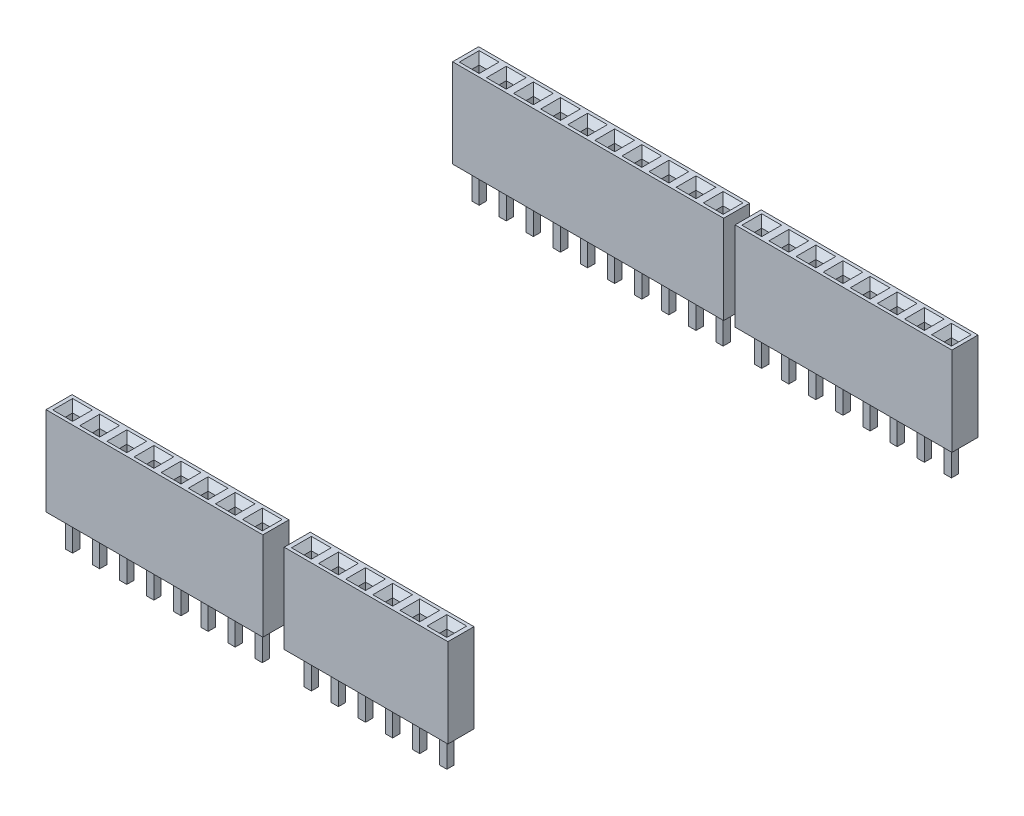
from build123d import *

# Parameters (mm, degrees)
ESQUISSE1_W             = 20.8
ESQUISSE1_H             = 2.5
BOSS_EXTRU_1_DEPTH      = 8.5
ESQUISSE1_W_2           = 15.7
BOSS_EXTRU_1_2_DEPTH    = 8.5
BOSS_EXTRU_1_3_DEPTH    = 8.5
ESQUISSE1_W_3           = 26
BOSS_EXTRU_1_4_DEPTH    = 8.5
ESQUISSE2_W             = 0.7
ESQUISSE2_H             = 0.7
BOSS_EXTRU_2_DEPTH      = 3.2
CHANFREIN1_SIZE         = 0.15
CHANFREIN2_SIZE         = 0.15
CHANFREIN3_SIZE         = 0.15
CHANFREIN4_SIZE         = 0.15
ESQUISSE3_W             = 0.7
ESQUISSE3_H             = 0.7
ENL_V_MAT_EXTRU_1_DEPTH = 7
CHANFREIN5_SIZE         = 0.6
CHANFREIN6_SIZE         = 0.6
CHANFREIN7_SIZE         = 0.6
CHANFREIN8_SIZE         = 0.6


with BuildPart() as part:
    # Esquisse1 → Boss.-Extru.1 (new body)
    with BuildSketch(Plane(origin=(0, 0, 0), x_dir=(1, 0, 0), z_dir=(0, 1, 0))):
        with Locations((10.4, 1.25)):
            Rectangle(ESQUISSE1_W, ESQUISSE1_H)
    extrude(amount=BOSS_EXTRU_1_DEPTH)



with BuildPart() as body_2:
    # Esquisse1 → Boss.-Extru.1 2 (new body)
    with BuildSketch(Plane(origin=(0, 0, 0), x_dir=(1, 0, 0), z_dir=(0, 1, 0))):
        with Locations((30.7, 1.25)):
            Rectangle(ESQUISSE1_W_2, ESQUISSE1_H)
    extrude(amount=BOSS_EXTRU_1_2_DEPTH)


with BuildPart() as body_3:
    # Esquisse1 → Boss.-Extru.1 3 (new body)
    with BuildSketch(Plane(origin=(0, 0, 0), x_dir=(1, 0, 0), z_dir=(0, 1, 0))):
        with Locations((28.1, 49.65)):
            Rectangle(ESQUISSE1_W, ESQUISSE1_H)
    extrude(amount=BOSS_EXTRU_1_3_DEPTH)


with BuildPart() as body_4:
    # Esquisse1 → Boss.-Extru.1 4 (new body)
    with BuildSketch(Plane(origin=(0, 0, 0), x_dir=(1, 0, 0), z_dir=(0, 1, 0))):
        with Locations((3.6, 49.65)):
            Rectangle(ESQUISSE1_W_3, ESQUISSE1_H)
    extrude(amount=BOSS_EXTRU_1_4_DEPTH)


with BuildPart() as part_1:
    add(part.part)

    add(body_2.part)  # Boss.-Extru.2 merges body 2

    add(body_3.part)  # Boss.-Extru.2 merges body 3

    add(body_4.part)  # Boss.-Extru.2 merges body 4
    # Esquisse2 → Boss.-Extru.2 (add)
    with BuildSketch(Plane.XZ):
        with Locations((1.3, -1.25)):
            Rectangle(ESQUISSE2_W, ESQUISSE2_H)
        with Locations((3.9, -1.25)):
            Rectangle(ESQUISSE2_W, ESQUISSE2_H)
        with Locations((6.5, -1.25)):
            Rectangle(ESQUISSE2_W, ESQUISSE2_H)
        with Locations((9.1, -1.25)):
            Rectangle(ESQUISSE2_W, ESQUISSE2_H)
        with Locations((11.7, -1.25)):
            Rectangle(ESQUISSE2_W, ESQUISSE2_H)
        with Locations((14.3, -1.25)):
            Rectangle(ESQUISSE2_W, ESQUISSE2_H)
        with Locations((16.9, -1.25)):
            Rectangle(ESQUISSE2_W, ESQUISSE2_H)
        with Locations((19.5, -1.25)):
            Rectangle(ESQUISSE2_W, ESQUISSE2_H)
        with Locations((24.2, -1.25)):
            Rectangle(ESQUISSE2_W, ESQUISSE2_H)
        with Locations((26.8, -1.25)):
            Rectangle(ESQUISSE2_W, ESQUISSE2_H)
        with Locations((29.4, -1.25)):
            Rectangle(ESQUISSE2_W, ESQUISSE2_H)
        with Locations((32, -1.25)):
            Rectangle(ESQUISSE2_W, ESQUISSE2_H)
        with Locations((34.6, -1.25)):
            Rectangle(ESQUISSE2_W, ESQUISSE2_H)
        with Locations((37.2, -1.25)):
            Rectangle(ESQUISSE2_W, ESQUISSE2_H)
        with Locations((-8.1, -49.65)):
            Rectangle(ESQUISSE2_W, ESQUISSE2_H)
        with Locations((-5.5, -49.65)):
            Rectangle(ESQUISSE2_W, ESQUISSE2_H)
        with Locations((-2.9, -49.65)):
            Rectangle(ESQUISSE2_W, ESQUISSE2_H)
        with Locations((-0.3, -49.65)):
            Rectangle(ESQUISSE2_W, ESQUISSE2_H)
        with Locations((2.3, -49.65)):
            Rectangle(ESQUISSE2_W, ESQUISSE2_H)
        with Locations((4.9, -49.65)):
            Rectangle(ESQUISSE2_W, ESQUISSE2_H)
        with Locations((7.5, -49.65)):
            Rectangle(ESQUISSE2_W, ESQUISSE2_H)
        with Locations((10.1, -49.65)):
            Rectangle(ESQUISSE2_W, ESQUISSE2_H)
        with Locations((12.7, -49.65)):
            Rectangle(ESQUISSE2_W, ESQUISSE2_H)
        with Locations((15.3, -49.65)):
            Rectangle(ESQUISSE2_W, ESQUISSE2_H)
        with Locations((19, -49.65)):
            Rectangle(ESQUISSE2_W, ESQUISSE2_H)
        with Locations((21.6, -49.65)):
            Rectangle(ESQUISSE2_W, ESQUISSE2_H)
        with Locations((24.2, -49.65)):
            Rectangle(ESQUISSE2_W, ESQUISSE2_H)
        with Locations((26.8, -49.65)):
            Rectangle(ESQUISSE2_W, ESQUISSE2_H)
        with Locations((29.4, -49.65)):
            Rectangle(ESQUISSE2_W, ESQUISSE2_H)
        with Locations((32, -49.65)):
            Rectangle(ESQUISSE2_W, ESQUISSE2_H)
        with Locations((34.6, -49.65)):
            Rectangle(ESQUISSE2_W, ESQUISSE2_H)
        with Locations((37.2, -49.65)):
            Rectangle(ESQUISSE2_W, ESQUISSE2_H)
    extrude(amount=BOSS_EXTRU_2_DEPTH)

    # Chanfrein1
    chanfrein1_edges = [part_1.edges().sort_by_distance(p)[0] for p in [
        (19.5, -3.2, -0.9),
        (19.85, -3.2, -1.25),
        (19.5, -3.2, -1.6),
        (19.15, -3.2, -1.25),
        (16.9, -3.2, -0.9),
        (17.25, -3.2, -1.25),
        (16.9, -3.2, -1.6),
        (16.55, -3.2, -1.25),
        (14.3, -3.2, -0.9),
        (14.65, -3.2, -1.25),
        (14.3, -3.2, -1.6),
        (13.95, -3.2, -1.25),
        (11.7, -3.2, -0.9),
        (12.05, -3.2, -1.25),
        (11.7, -3.2, -1.6),
        (11.35, -3.2, -1.25),
        (9.1, -3.2, -0.9),
        (9.45, -3.2, -1.25),
        (9.1, -3.2, -1.6),
        (8.75, -3.2, -1.25),
        (6.5, -3.2, -0.9),
        (6.85, -3.2, -1.25),
        (6.5, -3.2, -1.6),
        (6.15, -3.2, -1.25),
        (3.9, -3.2, -0.9),
        (4.25, -3.2, -1.25),
        (3.9, -3.2, -1.6),
        (3.55, -3.2, -1.25),
        (1.3, -3.2, -0.9),
        (1.65, -3.2, -1.25),
        (1.3, -3.2, -1.6),
        (0.95, -3.2, -1.25),
    ]]
    chamfer(chanfrein1_edges, length=CHANFREIN1_SIZE)

    # Chanfrein2
    chanfrein2_edges = [part_1.edges().sort_by_distance(p)[0] for p in [
        (37.2, -3.2, -0.9),
        (37.55, -3.2, -1.25),
        (37.2, -3.2, -1.6),
        (36.85, -3.2, -1.25),
        (34.6, -3.2, -0.9),
        (34.95, -3.2, -1.25),
        (34.6, -3.2, -1.6),
        (34.25, -3.2, -1.25),
        (32, -3.2, -0.9),
        (32.35, -3.2, -1.25),
        (32, -3.2, -1.6),
        (31.65, -3.2, -1.25),
        (29.4, -3.2, -0.9),
        (29.75, -3.2, -1.25),
        (29.4, -3.2, -1.6),
        (29.05, -3.2, -1.25),
        (26.8, -3.2, -0.9),
        (27.15, -3.2, -1.25),
        (26.8, -3.2, -1.6),
        (26.45, -3.2, -1.25),
        (24.2, -3.2, -0.9),
        (24.55, -3.2, -1.25),
        (24.2, -3.2, -1.6),
        (23.85, -3.2, -1.25),
    ]]
    chamfer(chanfrein2_edges, length=CHANFREIN2_SIZE)

    # Chanfrein3
    chanfrein3_edges = [part_1.edges().sort_by_distance(p)[0] for p in [
        (15.3, -3.2, -49.3),
        (15.65, -3.2, -49.65),
        (15.3, -3.2, -50),
        (14.95, -3.2, -49.65),
        (12.7, -3.2, -49.3),
        (13.05, -3.2, -49.65),
        (12.7, -3.2, -50),
        (12.35, -3.2, -49.65),
        (10.1, -3.2, -49.3),
        (10.45, -3.2, -49.65),
        (10.1, -3.2, -50),
        (9.75, -3.2, -49.65),
        (7.5, -3.2, -49.3),
        (7.85, -3.2, -49.65),
        (7.5, -3.2, -50),
        (7.15, -3.2, -49.65),
        (4.9, -3.2, -49.3),
        (5.25, -3.2, -49.65),
        (4.9, -3.2, -50),
        (4.55, -3.2, -49.65),
        (2.3, -3.2, -49.3),
        (2.65, -3.2, -49.65),
        (2.3, -3.2, -50),
        (1.95, -3.2, -49.65),
        (-0.3, -3.2, -49.3),
        (0.05, -3.2, -49.65),
        (-0.3, -3.2, -50),
        (-0.65, -3.2, -49.65),
        (-2.9, -3.2, -49.3),
        (-2.55, -3.2, -49.65),
        (-2.9, -3.2, -50),
        (-3.25, -3.2, -49.65),
        (-5.5, -3.2, -49.3),
        (-5.15, -3.2, -49.65),
        (-5.5, -3.2, -50),
        (-5.85, -3.2, -49.65),
        (-8.1, -3.2, -49.3),
        (-7.75, -3.2, -49.65),
        (-8.1, -3.2, -50),
        (-8.45, -3.2, -49.65),
    ]]
    chamfer(chanfrein3_edges, length=CHANFREIN3_SIZE)

    # Chanfrein4
    chanfrein4_edges = [part_1.edges().sort_by_distance(p)[0] for p in [
        (19, -3.2, -49.3),
        (19.35, -3.2, -49.65),
        (19, -3.2, -50),
        (18.65, -3.2, -49.65),
        (37.2, -3.2, -49.3),
        (37.55, -3.2, -49.65),
        (37.2, -3.2, -50),
        (36.85, -3.2, -49.65),
        (34.6, -3.2, -49.3),
        (34.95, -3.2, -49.65),
        (34.6, -3.2, -50),
        (34.25, -3.2, -49.65),
        (32, -3.2, -49.3),
        (32.35, -3.2, -49.65),
        (32, -3.2, -50),
        (31.65, -3.2, -49.65),
        (29.4, -3.2, -49.3),
        (29.75, -3.2, -49.65),
        (29.4, -3.2, -50),
        (29.05, -3.2, -49.65),
        (26.8, -3.2, -49.3),
        (27.15, -3.2, -49.65),
        (26.8, -3.2, -50),
        (26.45, -3.2, -49.65),
        (24.2, -3.2, -49.3),
        (24.55, -3.2, -49.65),
        (24.2, -3.2, -50),
        (23.85, -3.2, -49.65),
        (21.6, -3.2, -49.3),
        (21.95, -3.2, -49.65),
        (21.6, -3.2, -50),
        (21.25, -3.2, -49.65),
    ]]
    chamfer(chanfrein4_edges, length=CHANFREIN4_SIZE)

    # Esquisse3 → Enlèv. mat.-Extru.1 (cut)
    with BuildSketch(Plane(origin=(0, 8.5, 0), x_dir=(1, 0, 0), z_dir=(0, 1, 0))):
        with Locations((24.2, 49.65)):
            Rectangle(ESQUISSE3_W, ESQUISSE3_H)
        with Locations((21.6, 49.65)):
            Rectangle(ESQUISSE3_W, ESQUISSE3_H)
        with Locations((29.4, 49.65)):
            Rectangle(ESQUISSE3_W, ESQUISSE3_H)
        with Locations((26.8, 49.65)):
            Rectangle(ESQUISSE3_W, ESQUISSE3_H)
        with Locations((34.6, 49.65)):
            Rectangle(ESQUISSE3_W, ESQUISSE3_H)
        with Locations((32, 49.65)):
            Rectangle(ESQUISSE3_W, ESQUISSE3_H)
        with Locations((3.9, 1.25)):
            Rectangle(ESQUISSE3_W, ESQUISSE3_H)
        with Locations((1.3, 1.25)):
            Rectangle(ESQUISSE3_W, ESQUISSE3_H)
        with Locations((37.2, 49.65)):
            Rectangle(ESQUISSE3_W, ESQUISSE3_H)
        with Locations((6.5, 1.25)):
            Rectangle(ESQUISSE3_W, ESQUISSE3_H)
        with Locations((11.7, 1.25)):
            Rectangle(ESQUISSE3_W, ESQUISSE3_H)
        with Locations((9.1, 1.25)):
            Rectangle(ESQUISSE3_W, ESQUISSE3_H)
        with Locations((16.9, 1.25)):
            Rectangle(ESQUISSE3_W, ESQUISSE3_H)
        with Locations((14.3, 1.25)):
            Rectangle(ESQUISSE3_W, ESQUISSE3_H)
        with Locations((19.5, 1.25)):
            Rectangle(ESQUISSE3_W, ESQUISSE3_H)
        with Locations((26.8, 1.25)):
            Rectangle(ESQUISSE3_W, ESQUISSE3_H)
        with Locations((24.2, 1.25)):
            Rectangle(ESQUISSE3_W, ESQUISSE3_H)
        with Locations((29.4, 1.25)):
            Rectangle(ESQUISSE3_W, ESQUISSE3_H)
        with Locations((34.6, 1.25)):
            Rectangle(ESQUISSE3_W, ESQUISSE3_H)
        with Locations((32, 1.25)):
            Rectangle(ESQUISSE3_W, ESQUISSE3_H)
        with Locations((37.2, 1.25)):
            Rectangle(ESQUISSE3_W, ESQUISSE3_H)
        with Locations((-5.5, 49.65)):
            Rectangle(ESQUISSE3_W, ESQUISSE3_H)
        with Locations((-8.1, 49.65)):
            Rectangle(ESQUISSE3_W, ESQUISSE3_H)
        with Locations((-0.3, 49.65)):
            Rectangle(ESQUISSE3_W, ESQUISSE3_H)
        with Locations((-2.9, 49.65)):
            Rectangle(ESQUISSE3_W, ESQUISSE3_H)
        with Locations((4.9, 49.65)):
            Rectangle(ESQUISSE3_W, ESQUISSE3_H)
        with Locations((2.3, 49.65)):
            Rectangle(ESQUISSE3_W, ESQUISSE3_H)
        with Locations((10.1, 49.65)):
            Rectangle(ESQUISSE3_W, ESQUISSE3_H)
        with Locations((7.5, 49.65)):
            Rectangle(ESQUISSE3_W, ESQUISSE3_H)
        with Locations((15.3, 49.65)):
            Rectangle(ESQUISSE3_W, ESQUISSE3_H)
        with Locations((12.7, 49.65)):
            Rectangle(ESQUISSE3_W, ESQUISSE3_H)
        with Locations((19, 49.65)):
            Rectangle(ESQUISSE3_W, ESQUISSE3_H)
    extrude(amount=-ENL_V_MAT_EXTRU_1_DEPTH, mode=Mode.SUBTRACT)

    # Chanfrein5
    chanfrein5_edges = [part_1.edges().sort_by_distance(p)[0] for p in [
        (-8.1, 8.5, -49.3),
        (-8.45, 8.5, -49.65),
        (-8.1, 8.5, -50),
        (-7.75, 8.5, -49.65),
        (15.3, 8.5, -49.3),
        (15.65, 8.5, -49.65),
        (15.3, 8.5, -50),
        (14.95, 8.5, -49.65),
        (12.7, 8.5, -49.3),
        (13.05, 8.5, -49.65),
        (12.7, 8.5, -50),
        (12.35, 8.5, -49.65),
        (10.1, 8.5, -49.3),
        (10.45, 8.5, -49.65),
        (10.1, 8.5, -50),
        (9.75, 8.5, -49.65),
        (7.5, 8.5, -49.3),
        (7.85, 8.5, -49.65),
        (7.5, 8.5, -50),
        (7.15, 8.5, -49.65),
        (4.9, 8.5, -49.3),
        (5.25, 8.5, -49.65),
        (4.9, 8.5, -50),
        (4.55, 8.5, -49.65),
        (2.3, 8.5, -49.3),
        (2.65, 8.5, -49.65),
        (2.3, 8.5, -50),
        (1.95, 8.5, -49.65),
        (-0.3, 8.5, -49.3),
        (0.05, 8.5, -49.65),
        (-0.3, 8.5, -50),
        (-0.65, 8.5, -49.65),
        (-2.9, 8.5, -49.3),
        (-2.55, 8.5, -49.65),
        (-2.9, 8.5, -50),
        (-3.25, 8.5, -49.65),
        (-5.5, 8.5, -49.3),
        (-5.15, 8.5, -49.65),
        (-5.5, 8.5, -50),
        (-5.85, 8.5, -49.65),
    ]]
    chamfer(chanfrein5_edges, length=CHANFREIN5_SIZE)

    # Chanfrein6
    chanfrein6_edges = [part_1.edges().sort_by_distance(p)[0] for p in [
        (37.2, 8.5, -49.3),
        (37.55, 8.5, -49.65),
        (37.2, 8.5, -50),
        (36.85, 8.5, -49.65),
        (34.6, 8.5, -49.3),
        (34.95, 8.5, -49.65),
        (34.6, 8.5, -50),
        (34.25, 8.5, -49.65),
        (32, 8.5, -49.3),
        (32.35, 8.5, -49.65),
        (32, 8.5, -50),
        (31.65, 8.5, -49.65),
        (29.4, 8.5, -49.3),
        (29.75, 8.5, -49.65),
        (29.4, 8.5, -50),
        (29.05, 8.5, -49.65),
        (26.8, 8.5, -49.3),
        (27.15, 8.5, -49.65),
        (26.8, 8.5, -50),
        (26.45, 8.5, -49.65),
        (24.2, 8.5, -49.3),
        (24.55, 8.5, -49.65),
        (24.2, 8.5, -50),
        (23.85, 8.5, -49.65),
        (21.6, 8.5, -49.3),
        (21.95, 8.5, -49.65),
        (21.6, 8.5, -50),
        (21.25, 8.5, -49.65),
        (19, 8.5, -49.3),
        (19.35, 8.5, -49.65),
        (19, 8.5, -50),
        (18.65, 8.5, -49.65),
    ]]
    chamfer(chanfrein6_edges, length=CHANFREIN6_SIZE)

    # Chanfrein7
    chanfrein7_edges = [part_1.edges().sort_by_distance(p)[0] for p in [
        (37.55, 8.5, -1.25),
        (37.2, 8.5, -1.6),
        (36.85, 8.5, -1.25),
        (37.2, 8.5, -0.9),
        (34.95, 8.5, -1.25),
        (34.6, 8.5, -1.6),
        (34.25, 8.5, -1.25),
        (34.6, 8.5, -0.9),
        (32.35, 8.5, -1.25),
        (32, 8.5, -1.6),
        (31.65, 8.5, -1.25),
        (32, 8.5, -0.9),
        (29.75, 8.5, -1.25),
        (29.4, 8.5, -1.6),
        (29.05, 8.5, -1.25),
        (29.4, 8.5, -0.9),
        (27.15, 8.5, -1.25),
        (26.8, 8.5, -1.6),
        (26.45, 8.5, -1.25),
        (26.8, 8.5, -0.9),
        (24.55, 8.5, -1.25),
        (24.2, 8.5, -1.6),
        (23.85, 8.5, -1.25),
        (24.2, 8.5, -0.9),
    ]]
    chamfer(chanfrein7_edges, length=CHANFREIN7_SIZE)

    # Chanfrein8
    chanfrein8_edges = [part_1.edges().sort_by_distance(p)[0] for p in [
        (1.65, 8.5, -1.25),
        (1.3, 8.5, -1.6),
        (0.95, 8.5, -1.25),
        (1.3, 8.5, -0.9),
        (4.25, 8.5, -1.25),
        (3.9, 8.5, -1.6),
        (3.55, 8.5, -1.25),
        (3.9, 8.5, -0.9),
        (6.85, 8.5, -1.25),
        (6.5, 8.5, -1.6),
        (6.15, 8.5, -1.25),
        (6.5, 8.5, -0.9),
        (9.45, 8.5, -1.25),
        (9.1, 8.5, -1.6),
        (8.75, 8.5, -1.25),
        (9.1, 8.5, -0.9),
        (12.05, 8.5, -1.25),
        (11.7, 8.5, -1.6),
        (11.35, 8.5, -1.25),
        (11.7, 8.5, -0.9),
        (14.65, 8.5, -1.25),
        (14.3, 8.5, -1.6),
        (13.95, 8.5, -1.25),
        (14.3, 8.5, -0.9),
        (17.25, 8.5, -1.25),
        (16.9, 8.5, -1.6),
        (16.55, 8.5, -1.25),
        (16.9, 8.5, -0.9),
        (19.85, 8.5, -1.25),
        (19.5, 8.5, -1.6),
        (19.15, 8.5, -1.25),
        (19.5, 8.5, -0.9),
    ]]
    chamfer(chanfrein8_edges, length=CHANFREIN8_SIZE)


solid = part_1.part
